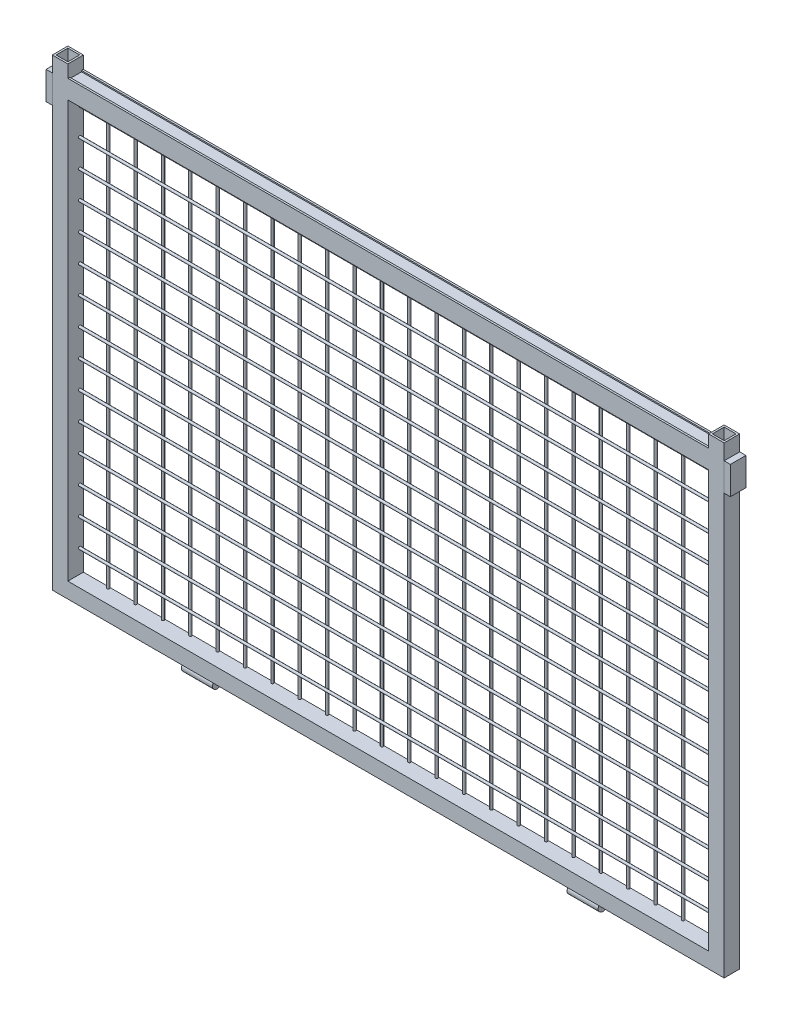
from build123d import *

# Parameters (mm, degrees)
SCHIZZO1_W                     = 25
SCHIZZO1_H                     = 25
SCHIZZO1_W_2                   = 19
SCHIZZO1_H_2                   = 19
ESTRUSIONE_ESTRUSIONE1_DEPTH   = 745
ESTRUSIONE_ESTRUSIONE1_2_DEPTH = 745
ESTRUSIONE_ESTRUSIONE2_REACH   = 1293.591
SCHIZZO2_W                     = 25
SCHIZZO2_H                     = 25
SCHIZZO2_W_2                   = 19
SCHIZZO2_H_2                   = 19
SCHIZZO4_R                     = 7.5
ESTRUSIONE_ESTRUSIONE3_DEPTH   = 50
SCHIZZO5_W                     = 25
SCHIZZO5_H                     = 45
ESTRUSIONE_ESTRUSIONE4_DEPTH   = 10
ESTRUSIONE_ESTRUSIONE5_REACH   = 908.122
SCHIZZO6_R                     = 2
ESTRUSIONE_ESTRUSIONE7_REACH   = 1301.772
SCHIZZO7_R                     = 2
SCHIZZO8_W                     = 1030
SCHIZZO8_H                     = 20
TAGLIO_ESTRUSIONE1_DEPTH       = 39
ESTRUSIONE_ESTRUSIONE8_REACH   = 1301.772
SCHIZZO9_W                     = 25
SCHIZZO9_H                     = 25


with BuildPart() as part:
    # Schizzo1 → Estrusione-Estrusione1 (new body)
    with BuildSketch(Plane(origin=(0, 0, 0), x_dir=(1, 0, 0), z_dir=(0, 1, 0))):
        with Locations((-527.5, 0)):
            Rectangle(SCHIZZO1_W, SCHIZZO1_H)
        with Locations((-527.5, 0)):
            Rectangle(SCHIZZO1_W_2, SCHIZZO1_H_2, mode=Mode.SUBTRACT)
    extrude(amount=ESTRUSIONE_ESTRUSIONE1_DEPTH)

    # Schizzo9 → Estrusione-Estrusione8 (add, up to next)
    with BuildSketch(Plane.ZY.offset(-515), mode=Mode.PRIVATE) as estrusione_estrusione8_sk1:
        with Locations((0, 707.5)):
            Rectangle(SCHIZZO9_W, SCHIZZO9_H)
    estrusione_estrusione8_tool1 = extrude(estrusione_estrusione8_sk1.sketch, amount=ESTRUSIONE_ESTRUSIONE8_REACH, mode=Mode.PRIVATE) - part.part


with BuildPart() as body_2:
    # Schizzo1 → Estrusione-Estrusione1 2 (new body)
    with BuildSketch(Plane(origin=(0, 0, 0), x_dir=(1, 0, 0), z_dir=(0, 1, 0))):
        with Locations((527.5, 0)):
            Rectangle(SCHIZZO1_W, SCHIZZO1_H)
        with Locations((527.5, 0)):
            Rectangle(SCHIZZO1_W_2, SCHIZZO1_H_2, mode=Mode.SUBTRACT)
    extrude(amount=ESTRUSIONE_ESTRUSIONE1_2_DEPTH)


with BuildPart() as body_3:

    # Schizzo2 → Estrusione-Estrusione2 (new, up to next)
    with BuildSketch(Plane(origin=(-515, 0, 0), x_dir=(0, 0, -1), z_dir=(1, 0, 0)), mode=Mode.PRIVATE) as estrusione_estrusione2_sk1:
        with Locations((0, 12.5)):
            Rectangle(SCHIZZO2_W, SCHIZZO2_H)
        with Locations((0, 12.5)):
            Rectangle(SCHIZZO2_W_2, SCHIZZO2_H_2, mode=Mode.SUBTRACT)
    estrusione_estrusione2_tool1 = extrude(estrusione_estrusione2_sk1.sketch, amount=ESTRUSIONE_ESTRUSIONE2_REACH, mode=Mode.PRIVATE) - body_2.part
    # Schizzo2 → Estrusione-Estrusione2 (new, up to next)
    with BuildSketch(Plane(origin=(-515, 0, 0), x_dir=(0, 0, -1), z_dir=(1, 0, 0)), mode=Mode.PRIVATE) as estrusione_estrusione2_sk2:
        with Locations((0, 732.5)):
            Rectangle(SCHIZZO2_W, SCHIZZO2_H)
        with Locations((0, 732.5)):
            Rectangle(SCHIZZO2_W_2, SCHIZZO2_H_2, mode=Mode.SUBTRACT)
    estrusione_estrusione2_tool2 = extrude(estrusione_estrusione2_sk2.sketch, amount=ESTRUSIONE_ESTRUSIONE2_REACH, mode=Mode.PRIVATE) - body_2.part
    add(estrusione_estrusione2_tool1.solids().sort_by_distance((-515, 0.353553, 0))[0])
    add(estrusione_estrusione2_tool2.solids().sort_by_distance((-515, 732.5, -12.146447))[0])

    # Schizzo6 → Estrusione-Estrusione5 (add, up to next)
    with BuildSketch(Plane(origin=(0, 25, 0), x_dir=(1, 0, 0), z_dir=(0, 1, 0)), mode=Mode.PRIVATE) as estrusione_estrusione5_sk1:
        with Locations((-473, 10.5)):
            Circle(SCHIZZO6_R)
    estrusione_estrusione5_tool1 = extrude(estrusione_estrusione5_sk1.sketch, amount=ESTRUSIONE_ESTRUSIONE5_REACH, mode=Mode.PRIVATE) - body_3.part
    # Schizzo6 → Estrusione-Estrusione5 (add, up to next)
    with BuildSketch(Plane(origin=(0, 25, 0), x_dir=(1, 0, 0), z_dir=(0, 1, 0)), mode=Mode.PRIVATE) as estrusione_estrusione5_sk2:
        with Locations((-429, 10.5)):
            Circle(SCHIZZO6_R)
    estrusione_estrusione5_tool2 = extrude(estrusione_estrusione5_sk2.sketch, amount=ESTRUSIONE_ESTRUSIONE5_REACH, mode=Mode.PRIVATE) - body_3.part
    # Schizzo6 → Estrusione-Estrusione5 (add, up to next)
    with BuildSketch(Plane(origin=(0, 25, 0), x_dir=(1, 0, 0), z_dir=(0, 1, 0)), mode=Mode.PRIVATE) as estrusione_estrusione5_sk3:
        with Locations((-385, 10.5)):
            Circle(SCHIZZO6_R)
    estrusione_estrusione5_tool3 = extrude(estrusione_estrusione5_sk3.sketch, amount=ESTRUSIONE_ESTRUSIONE5_REACH, mode=Mode.PRIVATE) - body_3.part
    # Schizzo6 → Estrusione-Estrusione5 (add, up to next)
    with BuildSketch(Plane(origin=(0, 25, 0), x_dir=(1, 0, 0), z_dir=(0, 1, 0)), mode=Mode.PRIVATE) as estrusione_estrusione5_sk4:
        with Locations((-341, 10.5)):
            Circle(SCHIZZO6_R)
    estrusione_estrusione5_tool4 = extrude(estrusione_estrusione5_sk4.sketch, amount=ESTRUSIONE_ESTRUSIONE5_REACH, mode=Mode.PRIVATE) - body_3.part
    # Schizzo6 → Estrusione-Estrusione5 (add, up to next)
    with BuildSketch(Plane(origin=(0, 25, 0), x_dir=(1, 0, 0), z_dir=(0, 1, 0)), mode=Mode.PRIVATE) as estrusione_estrusione5_sk5:
        with Locations((-297, 10.5)):
            Circle(SCHIZZO6_R)
    estrusione_estrusione5_tool5 = extrude(estrusione_estrusione5_sk5.sketch, amount=ESTRUSIONE_ESTRUSIONE5_REACH, mode=Mode.PRIVATE) - body_3.part
    # Schizzo6 → Estrusione-Estrusione5 (add, up to next)
    with BuildSketch(Plane(origin=(0, 25, 0), x_dir=(1, 0, 0), z_dir=(0, 1, 0)), mode=Mode.PRIVATE) as estrusione_estrusione5_sk6:
        with Locations((-253, 10.5)):
            Circle(SCHIZZO6_R)
    estrusione_estrusione5_tool6 = extrude(estrusione_estrusione5_sk6.sketch, amount=ESTRUSIONE_ESTRUSIONE5_REACH, mode=Mode.PRIVATE) - body_3.part
    # Schizzo6 → Estrusione-Estrusione5 (add, up to next)
    with BuildSketch(Plane(origin=(0, 25, 0), x_dir=(1, 0, 0), z_dir=(0, 1, 0)), mode=Mode.PRIVATE) as estrusione_estrusione5_sk7:
        with Locations((-209, 10.5)):
            Circle(SCHIZZO6_R)
    estrusione_estrusione5_tool7 = extrude(estrusione_estrusione5_sk7.sketch, amount=ESTRUSIONE_ESTRUSIONE5_REACH, mode=Mode.PRIVATE) - body_3.part
    # Schizzo6 → Estrusione-Estrusione5 (add, up to next)
    with BuildSketch(Plane(origin=(0, 25, 0), x_dir=(1, 0, 0), z_dir=(0, 1, 0)), mode=Mode.PRIVATE) as estrusione_estrusione5_sk8:
        with Locations((-165, 10.5)):
            Circle(SCHIZZO6_R)
    estrusione_estrusione5_tool8 = extrude(estrusione_estrusione5_sk8.sketch, amount=ESTRUSIONE_ESTRUSIONE5_REACH, mode=Mode.PRIVATE) - body_3.part
    # Schizzo6 → Estrusione-Estrusione5 (add, up to next)
    with BuildSketch(Plane(origin=(0, 25, 0), x_dir=(1, 0, 0), z_dir=(0, 1, 0)), mode=Mode.PRIVATE) as estrusione_estrusione5_sk9:
        with Locations((-121, 10.5)):
            Circle(SCHIZZO6_R)
    estrusione_estrusione5_tool9 = extrude(estrusione_estrusione5_sk9.sketch, amount=ESTRUSIONE_ESTRUSIONE5_REACH, mode=Mode.PRIVATE) - body_3.part
    # Schizzo6 → Estrusione-Estrusione5 (add, up to next)
    with BuildSketch(Plane(origin=(0, 25, 0), x_dir=(1, 0, 0), z_dir=(0, 1, 0)), mode=Mode.PRIVATE) as estrusione_estrusione5_sk10:
        with Locations((-77, 10.5)):
            Circle(SCHIZZO6_R)
    estrusione_estrusione5_tool10 = extrude(estrusione_estrusione5_sk10.sketch, amount=ESTRUSIONE_ESTRUSIONE5_REACH, mode=Mode.PRIVATE) - body_3.part
    # Schizzo6 → Estrusione-Estrusione5 (add, up to next)
    with BuildSketch(Plane(origin=(0, 25, 0), x_dir=(1, 0, 0), z_dir=(0, 1, 0)), mode=Mode.PRIVATE) as estrusione_estrusione5_sk11:
        with Locations((-33, 10.5)):
            Circle(SCHIZZO6_R)
    estrusione_estrusione5_tool11 = extrude(estrusione_estrusione5_sk11.sketch, amount=ESTRUSIONE_ESTRUSIONE5_REACH, mode=Mode.PRIVATE) - body_3.part
    # Schizzo6 → Estrusione-Estrusione5 (add, up to next)
    with BuildSketch(Plane(origin=(0, 25, 0), x_dir=(1, 0, 0), z_dir=(0, 1, 0)), mode=Mode.PRIVATE) as estrusione_estrusione5_sk12:
        with Locations((11, 10.5)):
            Circle(SCHIZZO6_R)
    estrusione_estrusione5_tool12 = extrude(estrusione_estrusione5_sk12.sketch, amount=ESTRUSIONE_ESTRUSIONE5_REACH, mode=Mode.PRIVATE) - body_3.part
    # Schizzo6 → Estrusione-Estrusione5 (add, up to next)
    with BuildSketch(Plane(origin=(0, 25, 0), x_dir=(1, 0, 0), z_dir=(0, 1, 0)), mode=Mode.PRIVATE) as estrusione_estrusione5_sk13:
        with Locations((55, 10.5)):
            Circle(SCHIZZO6_R)
    estrusione_estrusione5_tool13 = extrude(estrusione_estrusione5_sk13.sketch, amount=ESTRUSIONE_ESTRUSIONE5_REACH, mode=Mode.PRIVATE) - body_3.part
    # Schizzo6 → Estrusione-Estrusione5 (add, up to next)
    with BuildSketch(Plane(origin=(0, 25, 0), x_dir=(1, 0, 0), z_dir=(0, 1, 0)), mode=Mode.PRIVATE) as estrusione_estrusione5_sk14:
        with Locations((99, 10.5)):
            Circle(SCHIZZO6_R)
    estrusione_estrusione5_tool14 = extrude(estrusione_estrusione5_sk14.sketch, amount=ESTRUSIONE_ESTRUSIONE5_REACH, mode=Mode.PRIVATE) - body_3.part
    # Schizzo6 → Estrusione-Estrusione5 (add, up to next)
    with BuildSketch(Plane(origin=(0, 25, 0), x_dir=(1, 0, 0), z_dir=(0, 1, 0)), mode=Mode.PRIVATE) as estrusione_estrusione5_sk15:
        with Locations((143, 10.5)):
            Circle(SCHIZZO6_R)
    estrusione_estrusione5_tool15 = extrude(estrusione_estrusione5_sk15.sketch, amount=ESTRUSIONE_ESTRUSIONE5_REACH, mode=Mode.PRIVATE) - body_3.part
    # Schizzo6 → Estrusione-Estrusione5 (add, up to next)
    with BuildSketch(Plane(origin=(0, 25, 0), x_dir=(1, 0, 0), z_dir=(0, 1, 0)), mode=Mode.PRIVATE) as estrusione_estrusione5_sk16:
        with Locations((187, 10.5)):
            Circle(SCHIZZO6_R)
    estrusione_estrusione5_tool16 = extrude(estrusione_estrusione5_sk16.sketch, amount=ESTRUSIONE_ESTRUSIONE5_REACH, mode=Mode.PRIVATE) - body_3.part
    # Schizzo6 → Estrusione-Estrusione5 (add, up to next)
    with BuildSketch(Plane(origin=(0, 25, 0), x_dir=(1, 0, 0), z_dir=(0, 1, 0)), mode=Mode.PRIVATE) as estrusione_estrusione5_sk17:
        with Locations((231, 10.5)):
            Circle(SCHIZZO6_R)
    estrusione_estrusione5_tool17 = extrude(estrusione_estrusione5_sk17.sketch, amount=ESTRUSIONE_ESTRUSIONE5_REACH, mode=Mode.PRIVATE) - body_3.part
    # Schizzo6 → Estrusione-Estrusione5 (add, up to next)
    with BuildSketch(Plane(origin=(0, 25, 0), x_dir=(1, 0, 0), z_dir=(0, 1, 0)), mode=Mode.PRIVATE) as estrusione_estrusione5_sk18:
        with Locations((275, 10.5)):
            Circle(SCHIZZO6_R)
    estrusione_estrusione5_tool18 = extrude(estrusione_estrusione5_sk18.sketch, amount=ESTRUSIONE_ESTRUSIONE5_REACH, mode=Mode.PRIVATE) - body_3.part
    # Schizzo6 → Estrusione-Estrusione5 (add, up to next)
    with BuildSketch(Plane(origin=(0, 25, 0), x_dir=(1, 0, 0), z_dir=(0, 1, 0)), mode=Mode.PRIVATE) as estrusione_estrusione5_sk19:
        with Locations((319, 10.5)):
            Circle(SCHIZZO6_R)
    estrusione_estrusione5_tool19 = extrude(estrusione_estrusione5_sk19.sketch, amount=ESTRUSIONE_ESTRUSIONE5_REACH, mode=Mode.PRIVATE) - body_3.part
    # Schizzo6 → Estrusione-Estrusione5 (add, up to next)
    with BuildSketch(Plane(origin=(0, 25, 0), x_dir=(1, 0, 0), z_dir=(0, 1, 0)), mode=Mode.PRIVATE) as estrusione_estrusione5_sk20:
        with Locations((363, 10.5)):
            Circle(SCHIZZO6_R)
    estrusione_estrusione5_tool20 = extrude(estrusione_estrusione5_sk20.sketch, amount=ESTRUSIONE_ESTRUSIONE5_REACH, mode=Mode.PRIVATE) - body_3.part
    # Schizzo6 → Estrusione-Estrusione5 (add, up to next)
    with BuildSketch(Plane(origin=(0, 25, 0), x_dir=(1, 0, 0), z_dir=(0, 1, 0)), mode=Mode.PRIVATE) as estrusione_estrusione5_sk21:
        with Locations((407, 10.5)):
            Circle(SCHIZZO6_R)
    estrusione_estrusione5_tool21 = extrude(estrusione_estrusione5_sk21.sketch, amount=ESTRUSIONE_ESTRUSIONE5_REACH, mode=Mode.PRIVATE) - body_3.part
    # Schizzo6 → Estrusione-Estrusione5 (add, up to next)
    with BuildSketch(Plane(origin=(0, 25, 0), x_dir=(1, 0, 0), z_dir=(0, 1, 0)), mode=Mode.PRIVATE) as estrusione_estrusione5_sk22:
        with Locations((451, 10.5)):
            Circle(SCHIZZO6_R)
    estrusione_estrusione5_tool22 = extrude(estrusione_estrusione5_sk22.sketch, amount=ESTRUSIONE_ESTRUSIONE5_REACH, mode=Mode.PRIVATE) - body_3.part
    # Schizzo6 → Estrusione-Estrusione5 (add, up to next)
    with BuildSketch(Plane(origin=(0, 25, 0), x_dir=(1, 0, 0), z_dir=(0, 1, 0)), mode=Mode.PRIVATE) as estrusione_estrusione5_sk23:
        with Locations((495, 10.5)):
            Circle(SCHIZZO6_R)
    estrusione_estrusione5_tool23 = extrude(estrusione_estrusione5_sk23.sketch, amount=ESTRUSIONE_ESTRUSIONE5_REACH, mode=Mode.PRIVATE) - body_3.part
    add(estrusione_estrusione5_tool1.solids().sort_by_distance((-473, 25, -10.5))[0])
    add(estrusione_estrusione5_tool2.solids().sort_by_distance((-429, 25, -10.5))[0])
    add(estrusione_estrusione5_tool3.solids().sort_by_distance((-385, 25, -10.5))[0])
    add(estrusione_estrusione5_tool4.solids().sort_by_distance((-341, 25, -10.5))[0])
    add(estrusione_estrusione5_tool5.solids().sort_by_distance((-297, 25, -10.5))[0])
    add(estrusione_estrusione5_tool6.solids().sort_by_distance((-253, 25, -10.5))[0])
    add(estrusione_estrusione5_tool7.solids().sort_by_distance((-209, 25, -10.5))[0])
    add(estrusione_estrusione5_tool8.solids().sort_by_distance((-165, 25, -10.5))[0])
    add(estrusione_estrusione5_tool9.solids().sort_by_distance((-121, 25, -10.5))[0])
    add(estrusione_estrusione5_tool10.solids().sort_by_distance((-77, 25, -10.5))[0])
    add(estrusione_estrusione5_tool11.solids().sort_by_distance((-33, 25, -10.5))[0])
    add(estrusione_estrusione5_tool12.solids().sort_by_distance((11, 25, -10.5))[0])
    add(estrusione_estrusione5_tool13.solids().sort_by_distance((55, 25, -10.5))[0])
    add(estrusione_estrusione5_tool14.solids().sort_by_distance((99, 25, -10.5))[0])
    add(estrusione_estrusione5_tool15.solids().sort_by_distance((143, 25, -10.5))[0])
    add(estrusione_estrusione5_tool16.solids().sort_by_distance((187, 25, -10.5))[0])
    add(estrusione_estrusione5_tool17.solids().sort_by_distance((231, 25, -10.5))[0])
    add(estrusione_estrusione5_tool18.solids().sort_by_distance((275, 25, -10.5))[0])
    add(estrusione_estrusione5_tool19.solids().sort_by_distance((319, 25, -10.5))[0])
    add(estrusione_estrusione5_tool20.solids().sort_by_distance((363, 25, -10.5))[0])
    add(estrusione_estrusione5_tool21.solids().sort_by_distance((407, 25, -10.5))[0])
    add(estrusione_estrusione5_tool22.solids().sort_by_distance((451, 25, -10.5))[0])
    add(estrusione_estrusione5_tool23.solids().sort_by_distance((495, 25, -10.5))[0])

    # Schizzo8 → Taglio-Estrusione1 (cut)
    with BuildSketch(Plane(origin=(0, 0, -12.5), x_dir=(-1, 0, 0), z_dir=(0, 0, -1))):
        with Locations((0, 735)):
            Rectangle(SCHIZZO8_W, SCHIZZO8_H)
    extrude(amount=-TAGLIO_ESTRUSIONE1_DEPTH, mode=Mode.SUBTRACT)


with BuildPart() as body_4:
    # Schizzo4 → Estrusione-Estrusione3 (new body)
    with BuildSketch(Plane(origin=(335, 0, 0), x_dir=(0, 0, -1), z_dir=(1, 0, 0))):
        with Locations((-2.5, -7.5)):
            Circle(SCHIZZO4_R)
    extrude(amount=-ESTRUSIONE_ESTRUSIONE3_DEPTH)


with BuildPart() as body_5:
    # Specchia1: mirrored copy
    add(body_4.part.mirror(Plane(origin=(0, 0, 0), x_dir=(0, 0, 1), z_dir=(1, 0, 0))))


with BuildPart() as body_6:
    # Schizzo5 → Estrusione-Estrusione4 (new body)
    with BuildSketch(Plane(origin=(540, 0, 0), x_dir=(0, 0, -1), z_dir=(1, 0, 0))):
        with Locations((0, 697.5)):
            Rectangle(SCHIZZO5_W, SCHIZZO5_H)
    extrude(amount=ESTRUSIONE_ESTRUSIONE4_DEPTH)


with BuildPart() as body_7:
    # Specchia2: mirrored copy
    add(body_6.part.mirror(Plane(origin=(0, 0, 0), x_dir=(0, 0, 1), z_dir=(1, 0, 0))))


with BuildPart() as body_8:

    # Schizzo7 → Estrusione-Estrusione7 (new, up to next)
    with BuildSketch(Plane(origin=(-515, 0, 0), x_dir=(0, 0, -1), z_dir=(1, 0, 0)), mode=Mode.PRIVATE) as estrusione_estrusione7_sk1:
        with Locations((6.5, 678)):
            Circle(SCHIZZO7_R)
    estrusione_estrusione7_tool1 = extrude(estrusione_estrusione7_sk1.sketch, amount=ESTRUSIONE_ESTRUSIONE7_REACH, mode=Mode.PRIVATE) - body_2.part
    # Schizzo7 → Estrusione-Estrusione7 (new, up to next)
    with BuildSketch(Plane(origin=(-515, 0, 0), x_dir=(0, 0, -1), z_dir=(1, 0, 0)), mode=Mode.PRIVATE) as estrusione_estrusione7_sk2:
        with Locations((6.5, 634)):
            Circle(SCHIZZO7_R)
    estrusione_estrusione7_tool2 = extrude(estrusione_estrusione7_sk2.sketch, amount=ESTRUSIONE_ESTRUSIONE7_REACH, mode=Mode.PRIVATE) - body_2.part
    # Schizzo7 → Estrusione-Estrusione7 (new, up to next)
    with BuildSketch(Plane(origin=(-515, 0, 0), x_dir=(0, 0, -1), z_dir=(1, 0, 0)), mode=Mode.PRIVATE) as estrusione_estrusione7_sk3:
        with Locations((6.5, 590)):
            Circle(SCHIZZO7_R)
    estrusione_estrusione7_tool3 = extrude(estrusione_estrusione7_sk3.sketch, amount=ESTRUSIONE_ESTRUSIONE7_REACH, mode=Mode.PRIVATE) - body_2.part
    # Schizzo7 → Estrusione-Estrusione7 (new, up to next)
    with BuildSketch(Plane(origin=(-515, 0, 0), x_dir=(0, 0, -1), z_dir=(1, 0, 0)), mode=Mode.PRIVATE) as estrusione_estrusione7_sk4:
        with Locations((6.5, 546)):
            Circle(SCHIZZO7_R)
    estrusione_estrusione7_tool4 = extrude(estrusione_estrusione7_sk4.sketch, amount=ESTRUSIONE_ESTRUSIONE7_REACH, mode=Mode.PRIVATE) - body_2.part
    # Schizzo7 → Estrusione-Estrusione7 (new, up to next)
    with BuildSketch(Plane(origin=(-515, 0, 0), x_dir=(0, 0, -1), z_dir=(1, 0, 0)), mode=Mode.PRIVATE) as estrusione_estrusione7_sk5:
        with Locations((6.5, 502)):
            Circle(SCHIZZO7_R)
    estrusione_estrusione7_tool5 = extrude(estrusione_estrusione7_sk5.sketch, amount=ESTRUSIONE_ESTRUSIONE7_REACH, mode=Mode.PRIVATE) - body_2.part
    # Schizzo7 → Estrusione-Estrusione7 (new, up to next)
    with BuildSketch(Plane(origin=(-515, 0, 0), x_dir=(0, 0, -1), z_dir=(1, 0, 0)), mode=Mode.PRIVATE) as estrusione_estrusione7_sk6:
        with Locations((6.5, 458)):
            Circle(SCHIZZO7_R)
    estrusione_estrusione7_tool6 = extrude(estrusione_estrusione7_sk6.sketch, amount=ESTRUSIONE_ESTRUSIONE7_REACH, mode=Mode.PRIVATE) - body_2.part
    # Schizzo7 → Estrusione-Estrusione7 (new, up to next)
    with BuildSketch(Plane(origin=(-515, 0, 0), x_dir=(0, 0, -1), z_dir=(1, 0, 0)), mode=Mode.PRIVATE) as estrusione_estrusione7_sk7:
        with Locations((6.5, 414)):
            Circle(SCHIZZO7_R)
    estrusione_estrusione7_tool7 = extrude(estrusione_estrusione7_sk7.sketch, amount=ESTRUSIONE_ESTRUSIONE7_REACH, mode=Mode.PRIVATE) - body_2.part
    # Schizzo7 → Estrusione-Estrusione7 (new, up to next)
    with BuildSketch(Plane(origin=(-515, 0, 0), x_dir=(0, 0, -1), z_dir=(1, 0, 0)), mode=Mode.PRIVATE) as estrusione_estrusione7_sk8:
        with Locations((6.5, 370)):
            Circle(SCHIZZO7_R)
    estrusione_estrusione7_tool8 = extrude(estrusione_estrusione7_sk8.sketch, amount=ESTRUSIONE_ESTRUSIONE7_REACH, mode=Mode.PRIVATE) - body_2.part
    # Schizzo7 → Estrusione-Estrusione7 (new, up to next)
    with BuildSketch(Plane(origin=(-515, 0, 0), x_dir=(0, 0, -1), z_dir=(1, 0, 0)), mode=Mode.PRIVATE) as estrusione_estrusione7_sk9:
        with Locations((6.5, 326)):
            Circle(SCHIZZO7_R)
    estrusione_estrusione7_tool9 = extrude(estrusione_estrusione7_sk9.sketch, amount=ESTRUSIONE_ESTRUSIONE7_REACH, mode=Mode.PRIVATE) - body_2.part
    # Schizzo7 → Estrusione-Estrusione7 (new, up to next)
    with BuildSketch(Plane(origin=(-515, 0, 0), x_dir=(0, 0, -1), z_dir=(1, 0, 0)), mode=Mode.PRIVATE) as estrusione_estrusione7_sk10:
        with Locations((6.5, 282)):
            Circle(SCHIZZO7_R)
    estrusione_estrusione7_tool10 = extrude(estrusione_estrusione7_sk10.sketch, amount=ESTRUSIONE_ESTRUSIONE7_REACH, mode=Mode.PRIVATE) - body_2.part
    # Schizzo7 → Estrusione-Estrusione7 (new, up to next)
    with BuildSketch(Plane(origin=(-515, 0, 0), x_dir=(0, 0, -1), z_dir=(1, 0, 0)), mode=Mode.PRIVATE) as estrusione_estrusione7_sk11:
        with Locations((6.5, 238)):
            Circle(SCHIZZO7_R)
    estrusione_estrusione7_tool11 = extrude(estrusione_estrusione7_sk11.sketch, amount=ESTRUSIONE_ESTRUSIONE7_REACH, mode=Mode.PRIVATE) - body_2.part
    # Schizzo7 → Estrusione-Estrusione7 (new, up to next)
    with BuildSketch(Plane(origin=(-515, 0, 0), x_dir=(0, 0, -1), z_dir=(1, 0, 0)), mode=Mode.PRIVATE) as estrusione_estrusione7_sk12:
        with Locations((6.5, 194)):
            Circle(SCHIZZO7_R)
    estrusione_estrusione7_tool12 = extrude(estrusione_estrusione7_sk12.sketch, amount=ESTRUSIONE_ESTRUSIONE7_REACH, mode=Mode.PRIVATE) - body_2.part
    # Schizzo7 → Estrusione-Estrusione7 (new, up to next)
    with BuildSketch(Plane(origin=(-515, 0, 0), x_dir=(0, 0, -1), z_dir=(1, 0, 0)), mode=Mode.PRIVATE) as estrusione_estrusione7_sk13:
        with Locations((6.5, 150)):
            Circle(SCHIZZO7_R)
    estrusione_estrusione7_tool13 = extrude(estrusione_estrusione7_sk13.sketch, amount=ESTRUSIONE_ESTRUSIONE7_REACH, mode=Mode.PRIVATE) - body_2.part
    # Schizzo7 → Estrusione-Estrusione7 (new, up to next)
    with BuildSketch(Plane(origin=(-515, 0, 0), x_dir=(0, 0, -1), z_dir=(1, 0, 0)), mode=Mode.PRIVATE) as estrusione_estrusione7_sk14:
        with Locations((6.5, 106)):
            Circle(SCHIZZO7_R)
    estrusione_estrusione7_tool14 = extrude(estrusione_estrusione7_sk14.sketch, amount=ESTRUSIONE_ESTRUSIONE7_REACH, mode=Mode.PRIVATE) - body_2.part
    # Schizzo7 → Estrusione-Estrusione7 (new, up to next)
    with BuildSketch(Plane(origin=(-515, 0, 0), x_dir=(0, 0, -1), z_dir=(1, 0, 0)), mode=Mode.PRIVATE) as estrusione_estrusione7_sk15:
        with Locations((6.5, 62)):
            Circle(SCHIZZO7_R)
    estrusione_estrusione7_tool15 = extrude(estrusione_estrusione7_sk15.sketch, amount=ESTRUSIONE_ESTRUSIONE7_REACH, mode=Mode.PRIVATE) - body_2.part
    add(estrusione_estrusione7_tool1.solids().sort_by_distance((-515, 678, -6.5))[0])
    add(estrusione_estrusione7_tool2.solids().sort_by_distance((-515, 634, -6.5))[0])
    add(estrusione_estrusione7_tool3.solids().sort_by_distance((-515, 590, -6.5))[0])
    add(estrusione_estrusione7_tool4.solids().sort_by_distance((-515, 546, -6.5))[0])
    add(estrusione_estrusione7_tool5.solids().sort_by_distance((-515, 502, -6.5))[0])
    add(estrusione_estrusione7_tool6.solids().sort_by_distance((-515, 458, -6.5))[0])
    add(estrusione_estrusione7_tool7.solids().sort_by_distance((-515, 414, -6.5))[0])
    add(estrusione_estrusione7_tool8.solids().sort_by_distance((-515, 370, -6.5))[0])
    add(estrusione_estrusione7_tool9.solids().sort_by_distance((-515, 326, -6.5))[0])
    add(estrusione_estrusione7_tool10.solids().sort_by_distance((-515, 282, -6.5))[0])
    add(estrusione_estrusione7_tool11.solids().sort_by_distance((-515, 238, -6.5))[0])
    add(estrusione_estrusione7_tool12.solids().sort_by_distance((-515, 194, -6.5))[0])
    add(estrusione_estrusione7_tool13.solids().sort_by_distance((-515, 150, -6.5))[0])
    add(estrusione_estrusione7_tool14.solids().sort_by_distance((-515, 106, -6.5))[0])
    add(estrusione_estrusione7_tool15.solids().sort_by_distance((-515, 62, -6.5))[0])


with BuildPart() as part_1:
    add(part.part)

    add(body_2.part)  # Estrusione-Estrusione8 merges body 2

    add(body_3.part)  # Estrusione-Estrusione8 merges body 3
    add(estrusione_estrusione8_tool1.solids().sort_by_distance((515, 707.5, 0))[0])


solid = Compound([body_4.part, body_5.part, body_6.part, body_7.part, body_8.part, part_1.part])
